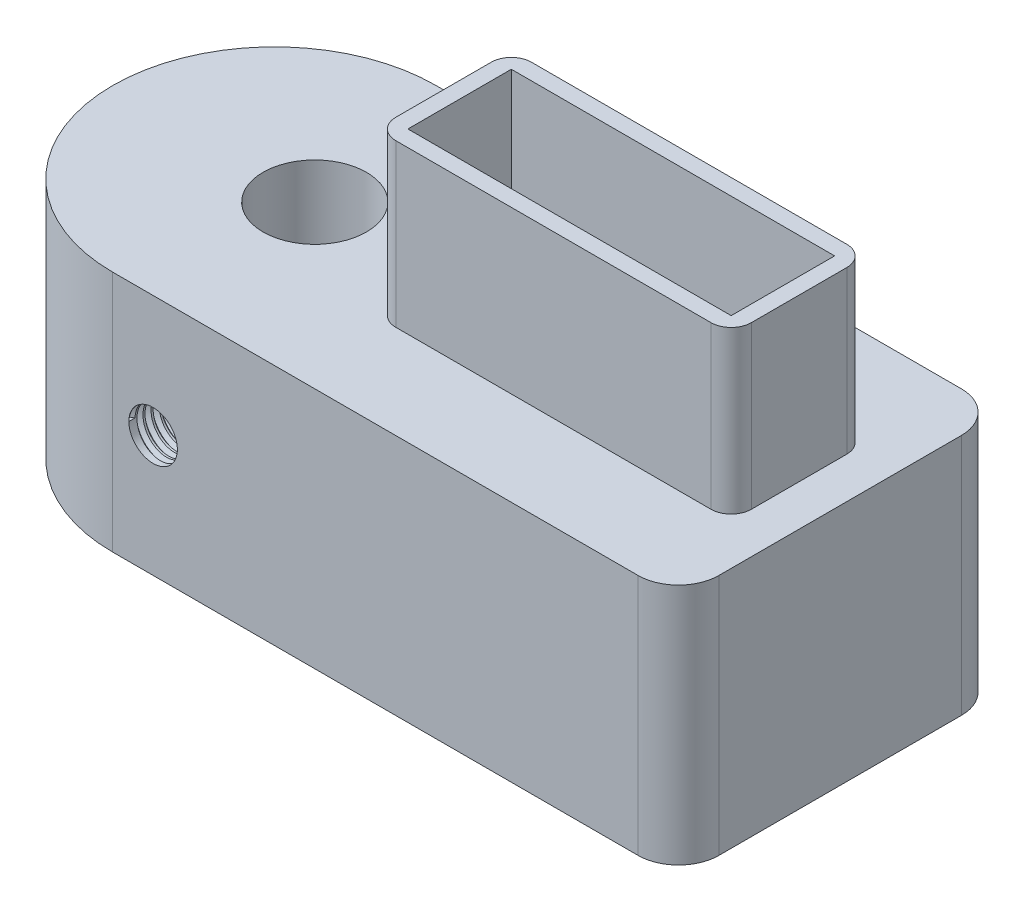
from build123d import *
from build123d.topology import SkipClean

# Parameters (mm, degrees)
SKETCH1_W           = 45
SKETCH1_H           = 20
BOSS_EXTRUDE1_DEPTH = 15
SKETCH2_R           = 3.2
CUT_EXTRUDE1_DEPTH  = 15
SKETCH3_R           = 1.5
CUT_EXTRUDE2_DEPTH  = 7.5
FILLET2_R           = 10
THREAD1_PITCH       = 0.5
FILLET3_R           = 2.5
SKETCH4_W           = 22
SKETCH4_H           = 8.4
BOSS_EXTRUDE2_DEPTH = 10
SKETCH5_W           = 20
SKETCH5_H           = 6.4
CUT_EXTRUDE3_DEPTH  = 25
FILLET4_R           = 1.25


with BuildPart() as part:
    # Sketch1 → Boss-Extrude1 (new body)
    with BuildSketch(Plane(origin=(0, 0, 0), x_dir=(1, 0, 0), z_dir=(0, 1, 0))):
        Rectangle(SKETCH1_W, SKETCH1_H)
    extrude(amount=BOSS_EXTRUDE1_DEPTH)

    # Sketch2 → Cut-Extrude1 (cut)
    with BuildSketch(Plane(origin=(0, 15, 0), x_dir=(1, 0, 0), z_dir=(0, 1, 0))):
        with Locations(Location((-10, 0, 0), (0, 0, 270))):
            Circle(SKETCH2_R)
    extrude(amount=-CUT_EXTRUDE1_DEPTH, mode=Mode.SUBTRACT)

    # Sketch3 → Cut-Extrude2 (cut)
    with BuildSketch(Plane.XY.offset(10)):
        with Locations((-10, 7.5)):
            Circle(SKETCH3_R)
    extrude(amount=-CUT_EXTRUDE2_DEPTH, mode=Mode.SUBTRACT)

    # Fillet2
    fillet2_edges = [part.edges().sort_by_distance(p)[0] for p in [
        (-22.5, 7.5, -10),
        (-22.5, 7.5, 10),
    ]]
    fillet(fillet2_edges, radius=FILLET2_R - 0.0001)  # a hair under: the kernel refuses the full size

    # Thread1: the profile of Thread Profile1 profile screwed along a right-hand helix of 13.4 turns, 6 arcs to a turn; built about Z, then put on its axis
    with SkipClean():  # the faces are left unmerged after this step: merging them gives an invalid solid
        thread1_z = Axis((0, 0, 0), (0, 0, 1))
        thread1_corners = [(1.4997, 0, -0.000173), (1.770633, 0, 0.15625), (1.770633, 0, 0.21875), (1.4997, 0, 0.375173)]
        with BuildLine(mode=Mode.PRIVATE) as thread1_profile:
            Line(thread1_corners[0], thread1_corners[1])
            Line(thread1_corners[1], thread1_corners[2])
            Line(thread1_corners[2], thread1_corners[3])
            Line(thread1_corners[3], thread1_corners[0])
        thread1_cap = Face(thread1_profile.wire())
        thread1_turn_angles = [0, 30, 60, 90, 120, 150, 180, 210, 240, 270, 300, 330, 360]
        thread1_turn_weights = [1, 0.8660254037844387, 1, 0.8660254037844387, 1, 0.8660254037844387, 1, 0.8660254037844387, 1, 0.8660254037844387, 1, 0.8660254037844387, 1]
        thread1_turn_rails = [Edge.make_bspline([Vector(p[0], p[1], 0).rotate(thread1_z, thread1_turn_angles[k]) / thread1_turn_weights[k] + Vector(0, 0, p[2] + THREAD1_PITCH * thread1_turn_angles[k] / 360) for k in range(13)], [0, 0, 0, 1, 1, 2, 2, 3, 3, 4, 4, 5, 5, 6, 6, 6], 2, thread1_turn_weights) for p in thread1_corners]
        thread1_turn_sides = [Face.make_surface_from_curves(thread1_turn_rails[p[0]], thread1_turn_rails[p[1]]) for p in [(0, 1), (1, 2), (2, 3), (3, 0)]]
        thread1_last_angles = [4680, 4710, 4740, 4770, 4800, 4812, 4824]
        thread1_last_weights = [1, 0.8660254037844387, 1, 0.8660254037844387, 1, 0.9781476007338057, 1]
        thread1_last_rails = [Edge.make_bspline([Vector(p[0], p[1], 0).rotate(thread1_z, thread1_last_angles[k]) / thread1_last_weights[k] + Vector(0, 0, p[2] + THREAD1_PITCH * thread1_last_angles[k] / 360) for k in range(7)], [0, 0, 0, 1, 1, 2, 2, 3, 3, 3], 2, thread1_last_weights) for p in thread1_corners]
        thread1_last_sides = [Face.make_surface_from_curves(thread1_last_rails[p[0]], thread1_last_rails[p[1]]) for p in [(0, 1), (1, 2), (2, 3), (3, 0)]]
        thread1 = Plane(origin=(-10, 7.5, 10), x_dir=(-1, 0, 0), z_dir=(0, 0, -1)) * Solid(Shell([*[p.moved(Location((0, 0, THREAD1_PITCH * i))) for i in range(13) for p in thread1_turn_sides], *thread1_last_sides, thread1_cap, thread1_cap.rotate(thread1_z, 4824).moved(Location((0, 0, THREAD1_PITCH * 4824 / 360)))]))
        add(thread1, mode=Mode.SUBTRACT)

    # Fillet3
    fillet3_edges = [part.edges().sort_by_distance(p)[0] for p in [
        (22.5, 7.5, 10),
        (22.5, 7.5, -10),
    ]]
    fillet(fillet3_edges, radius=FILLET3_R)

    # Sketch4 → Boss-Extrude2 (add)
    with SkipClean():  # the faces are left unmerged after this step: merging them gives an invalid solid
        with BuildSketch(Plane(origin=(0, 15, 0), x_dir=(1, 0, 0), z_dir=(0, 1, 0))):
            with Locations((8.96, 0)):
                Rectangle(SKETCH4_W, SKETCH4_H)
        extrude(amount=BOSS_EXTRUDE2_DEPTH)

    # Sketch5 → Cut-Extrude3 (cut)
    with SkipClean():  # the faces are left unmerged after this step: merging them gives an invalid solid
        with BuildSketch(Plane(origin=(0, 25, 0), x_dir=(1, 0, 0), z_dir=(0, 1, 0))):
            with Locations((8.96, 0)):
                Rectangle(SKETCH5_W, SKETCH5_H)
        extrude(amount=-CUT_EXTRUDE3_DEPTH, mode=Mode.SUBTRACT)

    # Fillet4
    fillet4_edges = [part.edges().sort_by_distance(p)[0] for p in [
        (-2.04, 20, -4.2),
        (-2.04, 20, 4.2),
        (19.96, 20, 4.2),
        (19.96, 20, -4.2),
    ]]
    fillet(fillet4_edges, radius=FILLET4_R)


solid = part.part
